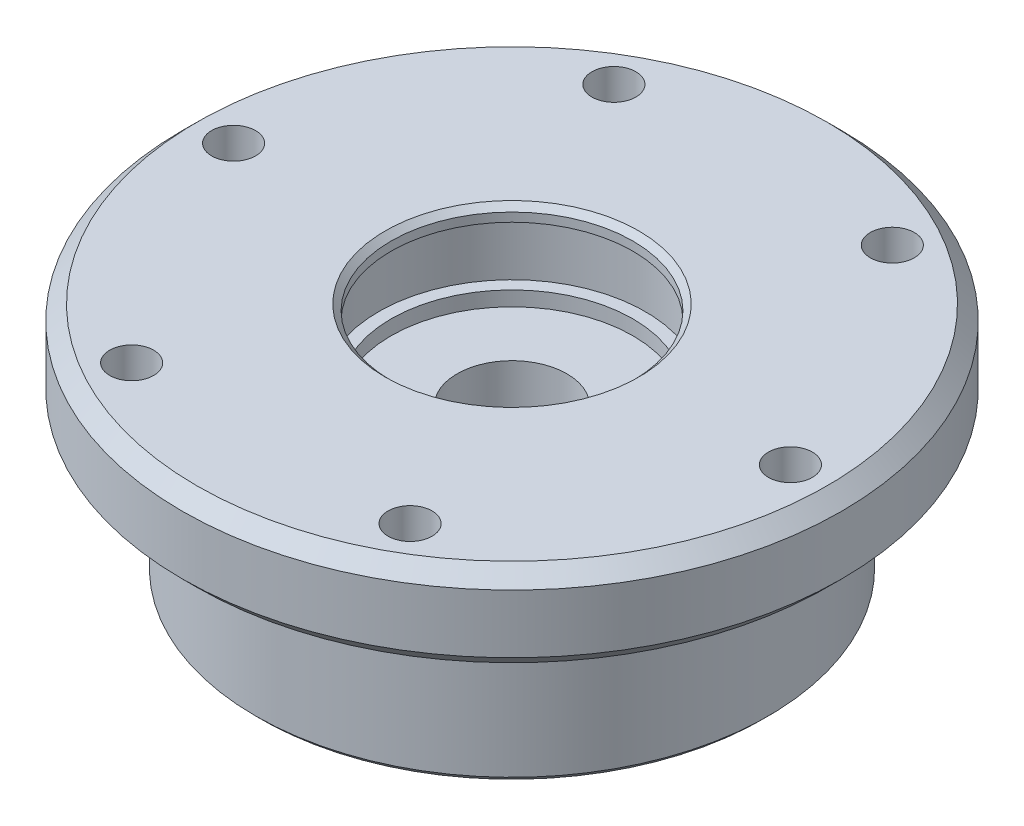
from build123d import *

# Parameters (mm, degrees)
SKETCH1_R           = 22.5
SKETCH1_R_2         = 1.5
SKETCH1_R_3         = 8.25
BOSS_EXTRUDE1_DEPTH = 3
SKETCH2_R           = 9.1
CUT_EXTRUDE1_DEPTH  = 2
SKETCH3_R           = 20.5
SKETCH3_R_2         = 17.5
BOSS_EXTRUDE2_DEPTH = 1
SKETCH4_R           = 17.5
SKETCH4_R_2         = 3.75
BOSS_EXTRUDE3_DEPTH = 10
SKETCH5_R           = 19
SKETCH5_R_2         = 17.5
BOSS_EXTRUDE4_DEPTH = 0.5
CHAMFER1_SIZE       = 1
CHAMFER3_SIZE       = 0.4
SKETCH6_R           = 2.35
CUT_EXTRUDE2_DEPTH  = 4
SKETCH7_R           = 1.75
CUT_EXTRUDE3_DEPTH  = 8
CHAMFER4_SIZE       = 0.4


with BuildPart() as part:
    # Sketch1 → Boss-Extrude1 (new, symmetric)
    with BuildSketch(Plane(origin=(0, 0, 0), x_dir=(1, 0, 0), z_dir=(0, 1, 0))):
        Circle(SKETCH1_R)
        with Locations((19, 0)):
            Circle(SKETCH1_R_2, mode=Mode.SUBTRACT)
        with Locations((9.5, -16.454482672)):
            Circle(SKETCH1_R_2, mode=Mode.SUBTRACT)
        with Locations((-9.5, -16.454482672)):
            Circle(SKETCH1_R_2, mode=Mode.SUBTRACT)
        with Locations((-19, 0)):
            Circle(SKETCH1_R_2, mode=Mode.SUBTRACT)
        with Locations((-9.5, 16.454482672)):
            Circle(SKETCH1_R_2, mode=Mode.SUBTRACT)
        with Locations((9.5, 16.454482672)):
            Circle(SKETCH1_R_2, mode=Mode.SUBTRACT)
        Circle(SKETCH1_R_3, mode=Mode.SUBTRACT)
    extrude(amount=BOSS_EXTRUDE1_DEPTH, both=True)

    # Sketch2 → Cut-Extrude1 (cut, symmetric)
    with BuildSketch(Plane(origin=(0, 0, 0), x_dir=(1, 0, 0), z_dir=(0, 1, 0))):
        Circle(SKETCH2_R)
    extrude(amount=CUT_EXTRUDE1_DEPTH, both=True, mode=Mode.SUBTRACT)

    # Sketch3 → Boss-Extrude2 (add)
    with BuildSketch(Plane(origin=(0, -3, 0), x_dir=(1, 0, 0), z_dir=(0, 1, 0))):
        Circle(SKETCH3_R)
        Circle(SKETCH3_R_2, mode=Mode.SUBTRACT)
    extrude(amount=BOSS_EXTRUDE2_DEPTH)

    # Sketch4 → Boss-Extrude3 (add)
    with BuildSketch(Plane.XZ.offset(3)):
        Circle(SKETCH4_R)
        Circle(SKETCH4_R_2, mode=Mode.SUBTRACT)
    extrude(amount=BOSS_EXTRUDE3_DEPTH)

    # Sketch5 → Boss-Extrude4 (add)
    with BuildSketch(Plane.XZ.offset(3)):
        Circle(SKETCH5_R)
        Circle(SKETCH5_R_2, mode=Mode.SUBTRACT)
    extrude(amount=BOSS_EXTRUDE4_DEPTH)

    # Chamfer1
    chamfer1_edges = [part.edges().sort_by_distance(p)[0] for p in [
        (-22.5, -3, 0),
        (-22.5, 3, 0),
    ]]
    chamfer(chamfer1_edges, length=CHAMFER1_SIZE)

    # Chamfer3
    chamfer3_edges = [part.edges().sort_by_distance(p)[0] for p in [
        (-8.25, 3, 0),
    ]]
    chamfer(chamfer3_edges, length=CHAMFER3_SIZE)

    # Sketch6 → Cut-Extrude2 (cut)
    with BuildSketch(Plane.XZ.offset(13)):
        with Locations((7.5, 0)):
            Circle(SKETCH6_R)
        with Locations((0, 7.5)):
            Circle(SKETCH6_R)
        with Locations((-7.5, 0)):
            Circle(SKETCH6_R)
        with Locations((0, -7.5)):
            Circle(SKETCH6_R)
    extrude(amount=-CUT_EXTRUDE2_DEPTH, mode=Mode.SUBTRACT)

    # Sketch7 → Cut-Extrude3 (cut)
    with BuildSketch(Plane.XZ.offset(13)):
        with Locations((0, 7.5)):
            Circle(SKETCH7_R)
        with Locations((7.5, 0)):
            Circle(SKETCH7_R)
        with Locations((0, -7.5)):
            Circle(SKETCH7_R)
        with Locations((-7.5, 0)):
            Circle(SKETCH7_R)
    extrude(amount=-CUT_EXTRUDE3_DEPTH, mode=Mode.SUBTRACT)

    # Chamfer4
    chamfer4_edges = [part.edges().sort_by_distance(p)[0] for p in [
        (-17.5, -13, 0),
    ]]
    chamfer(chamfer4_edges, length=CHAMFER4_SIZE)


solid = part.part
